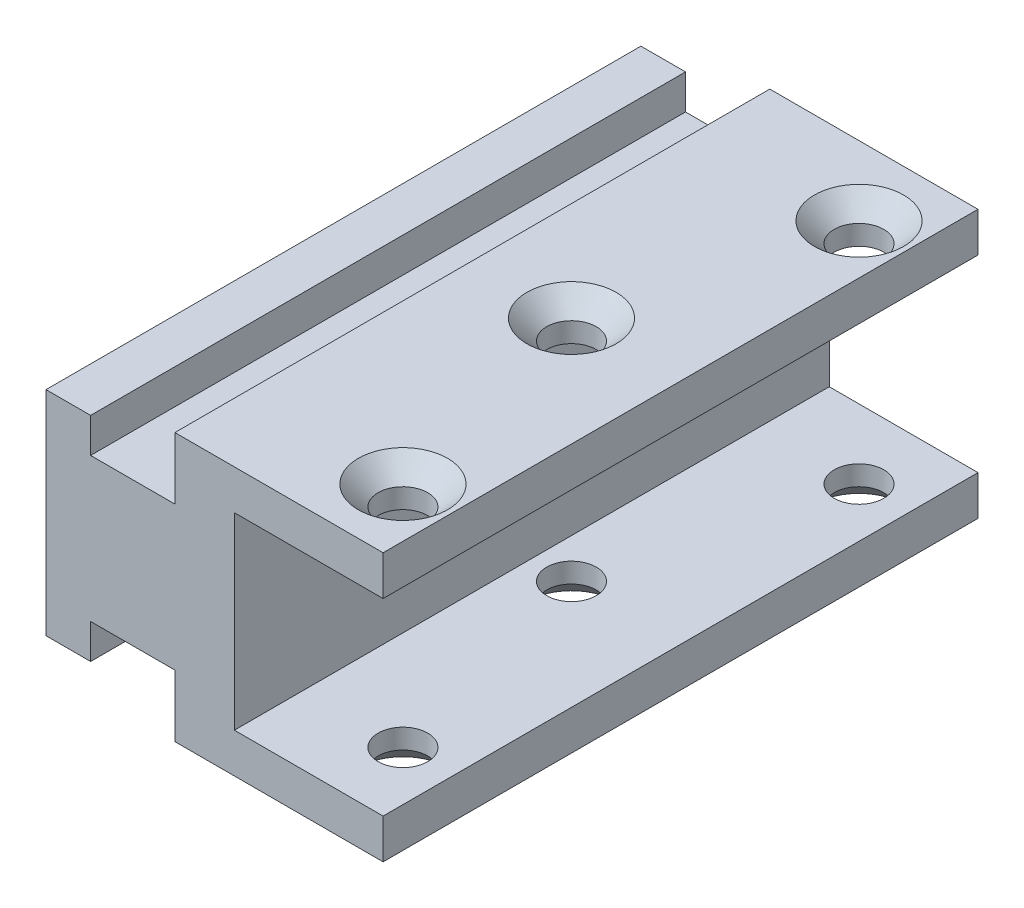
from build123d import *

# Parameters (mm, degrees)
BOSS_EXTRUDE1_DEPTH = 30
SKETCH2_R           = 2.5
CUT_EXTRUDE1_DEPTH  = 53.773099208
CHAMFER1_SIZE       = 2


with BuildPart() as part:
    # Sketch1 → Boss-Extrude1 (new, symmetric)
    with BuildSketch(Plane.XY):
        Polygon((0, -10.75), (0, 10.75), (4.5, 10.75), (4.5, 7.25), (13, 7.25), (13, 13.5), (34, 13.5), (34, 9.5), (19, 9.5), (19, -9.5), (34, -9.5), (34, -13.5), (13, -13.5), (13, -7.25), (4.5, -7.25), (4.5, -10.75), align=None)
    extrude(amount=BOSS_EXTRUDE1_DEPTH, both=True)

    # Sketch2 → Cut-Extrude1 (cut, through all)
    with BuildSketch(Plane.XZ.offset(13.5)):
        with Locations((29, 23)):
            Circle(SKETCH2_R)
        with Locations((23, 0)):
            Circle(SKETCH2_R)
        with Locations((29, -23)):
            Circle(SKETCH2_R)
    extrude(amount=-CUT_EXTRUDE1_DEPTH, mode=Mode.SUBTRACT)

    # Chamfer1
    chamfer1_edges = [part.edges().sort_by_distance(p)[0] for p in [
        (26.5, 13.5, -23),
        (20.5, 13.5, 0),
        (26.5, 13.5, 23),
        (26.5, -13.5, -23),
        (26.5, -13.5, 23),
        (20.5, -13.5, 0),
    ]]
    chamfer(chamfer1_edges, length=CHAMFER1_SIZE)


solid = part.part
